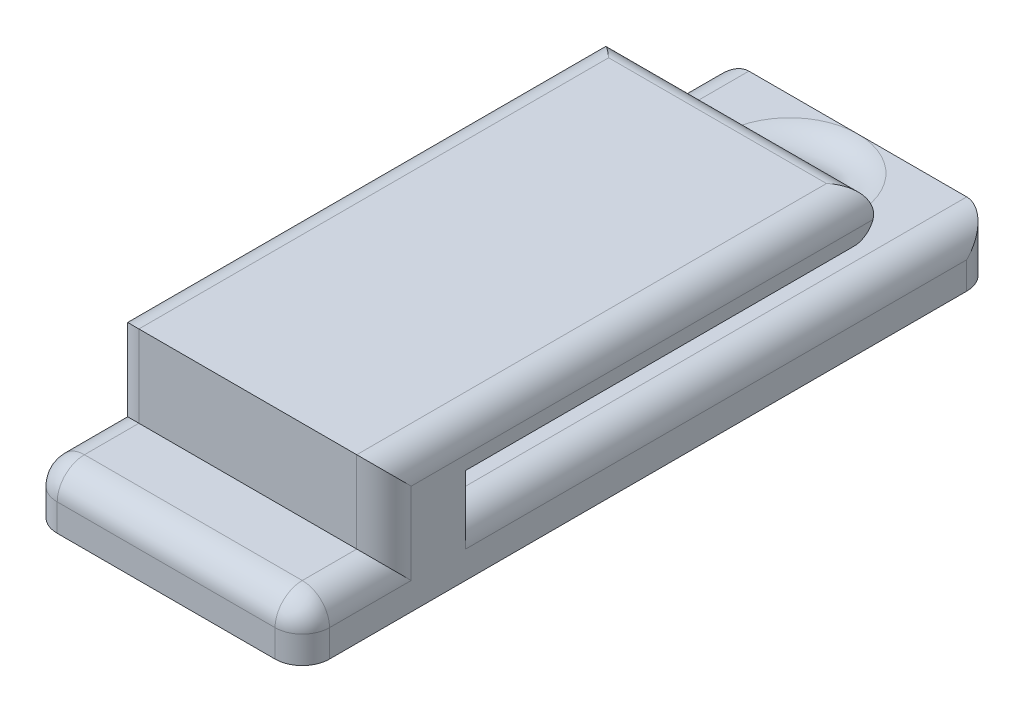
from build123d import *

# Parameters (mm, degrees)
SKETCH1_W           = 10
SKETCH1_H           = 25.4
BOSS_EXTRUDE1_DEPTH = 2
SKETCH3_W           = 10
SKETCH3_H           = 3
BOSS_EXTRUDE3_DEPTH = 3
SKETCH4_W           = 10
SKETCH4_H           = 1.5
BOSS_EXTRUDE4_DEPTH = 15
SKETCH5_R           = 1.5
CUT_EXTRUDE1_DEPTH  = 14.974619852
FILLET2_R           = 1
FILLET4_RADIUS      = 0.75
FILLET4_LENGTH      = 10
FILLET5_R           = 1
FILLET6_R           = 1
FILLET7_R           = 1
FILLET8_START       = -1
FILLET8_DEPTH       = 5
FILLET9_START       = -1
FILLET9_DEPTH       = 4
FILLET10_R          = 1
FILLET11_R          = 1


with BuildPart() as part:
    # Sketch1 → Boss-Extrude1 (new body)
    with BuildSketch(Plane(origin=(0, 0, 0), x_dir=(1, 0, 0), z_dir=(0, 1, 0))):
        Rectangle(SKETCH1_W, SKETCH1_H)
    extrude(amount=BOSS_EXTRUDE1_DEPTH)

    # Sketch3 → Boss-Extrude3 (add)
    with BuildSketch(Plane(origin=(0, 2, 0), x_dir=(1, 0, 0), z_dir=(0, 1, 0))):
        with Locations((0, -8.2)):
            Rectangle(SKETCH3_W, SKETCH3_H)
    extrude(amount=BOSS_EXTRUDE3_DEPTH)

    # Sketch4 → Boss-Extrude4 (add)
    with BuildSketch(Plane(origin=(0, 0, 6.7), x_dir=(-1, 0, 0), z_dir=(0, 0, -1))):
        with Locations((0, 4.25)):
            Rectangle(SKETCH4_W, SKETCH4_H)
    extrude(amount=BOSS_EXTRUDE4_DEPTH)

    # Sketch5 → Cut-Extrude1 (cut, through all)
    with BuildSketch(Plane(origin=(0, 2, 0), x_dir=(1, 0, 0), z_dir=(0, 1, 0))):
        with Locations(Location((0, 10.2, 0), (0, 0, 270))):
            Circle(SKETCH5_R)
    extrude(amount=-CUT_EXTRUDE1_DEPTH, mode=Mode.SUBTRACT)

    # Fillet2
    fillet2_edges = [part.edges().sort_by_distance(p)[0] for p in [
        (0, 2, -11.7),
    ]]
    fillet(fillet2_edges, radius=FILLET2_R - 0.0001)  # a hair under: the kernel refuses the full size

    # Fillet4: full round fillet: the end face becomes a half cylinder, R = half its width
    fillet4_face = Plane((0, 4.25, -8.3), x_dir=(1, 0, 0), z_dir=(0, 0, -1))  # on the end face: x along it, z out of the body
    fillet4_slab = fillet4_face.offset(-FILLET4_RADIUS / 2) * Box(FILLET4_LENGTH, 2 * FILLET4_RADIUS, FILLET4_RADIUS, mode=Mode.PRIVATE)  # the body's end, R deep
    fillet4_round = Plane((0, 4.25, -7.55), x_dir=(0, 0, -1), z_dir=(1, 0, 0)) * Cylinder(FILLET4_RADIUS, FILLET4_LENGTH, mode=Mode.PRIVATE)  # its axis R under the face
    add(fillet4_slab - fillet4_round, mode=Mode.SUBTRACT)

    # Fillet5
    # the kernel refuses this fillet: 1 mm, written as the material it takes off along each edge
    with BuildSketch(Plane(origin=(7.5, 2, 12.7), x_dir=(0, -1, 0), z_dir=(-1, 0, 0))) as fillet5_piece_1:
        with BuildLine():
            CenterArc((FILLET5_R, -FILLET5_R), FILLET5_R, 90, 90)
            Line((0, -FILLET5_R), (0, 0))
            Line((0, 0), (FILLET5_R, 0))
        make_face()
    extrude(amount=15, mode=Mode.SUBTRACT)
    with BuildSketch(Plane(origin=(-5, 2, 15.2), x_dir=(1, 0, 0), z_dir=(0, 0, -1)), Plane(origin=(-5, 2, 9.7), x_dir=(1, 0, 0), z_dir=(0, 1, 0)), Plane(origin=(5, 2, 9.7), x_dir=(0, 0, -1), z_dir=(0, 1, 0))) as fillet5_piece_2:
        with BuildLine():
            CenterArc((FILLET5_R, FILLET5_R), FILLET5_R, 180, 90)
            Line((0, FILLET5_R), (0, 0))
            Line((0, 0), (FILLET5_R, 0))
        make_face()
    extrude(amount=5.5, mode=Mode.SUBTRACT)
    with BuildSketch(Plane(origin=(5, 5, -10.05), x_dir=(0, -1, 0), z_dir=(0, 0, 1))) as fillet5_piece_3:
        with BuildLine():
            CenterArc((FILLET5_R, -FILLET5_R), FILLET5_R, 90, 90)
            Line((0, -FILLET5_R), (0, 0))
            Line((0, 0), (FILLET5_R, 0))
        make_face()
    extrude(amount=22.25, mode=Mode.SUBTRACT)
    with BuildSketch(Plane(origin=(5, 2, 9.7), x_dir=(0, -1, 0), z_dir=(0, 0, 1))) as fillet5_piece_4:
        with BuildLine():
            CenterArc((FILLET5_R, -FILLET5_R), FILLET5_R, 90, 90)
            Line((0, -FILLET5_R), (0, 0))
            Line((0, 0), (FILLET5_R, 0))
        make_face()
    extrude(amount=5.5, mode=Mode.SUBTRACT)
    with BuildSketch(Plane(origin=(-5, 5, 12.2), x_dir=(1, 0, 0), z_dir=(0, 0, -1))) as fillet5_piece_5:
        with BuildLine():
            CenterArc((FILLET5_R, FILLET5_R), FILLET5_R, 180, 90)
            Line((0, FILLET5_R), (0, 0))
            Line((0, 0), (FILLET5_R, 0))
        make_face()
    extrude(amount=22.25, mode=Mode.SUBTRACT)
    with BuildSketch(Plane(origin=(-5, 2, 15.2), x_dir=(1, 0, 0), z_dir=(0, 0, -1))) as fillet5_piece_6a_section:
        with BuildLine():
            CenterArc((FILLET5_R, FILLET5_R), FILLET5_R, 180, 90)
            Line((0, FILLET5_R), (0, 0))
            Line((0, 0), (FILLET5_R, 0))
        make_face()
    fillet5_piece_6a = extrude(amount=8, mode=Mode.PRIVATE)
    fillet5_piece_6a = split(fillet5_piece_6a, bisect_by=Plane(origin=(-5, 2, 9.7), z_dir=(0, 0, -1)), keep=Keep.TOP, mode=Mode.PRIVATE)
    with BuildSketch(Plane(origin=(-5, -0.5, 9.7), x_dir=(1, 0, 0), z_dir=(0, 1, 0))) as fillet5_piece_6b_section:
        with BuildLine():
            CenterArc((FILLET5_R, FILLET5_R), FILLET5_R, 180, 90)
            Line((0, FILLET5_R), (0, 0))
            Line((0, 0), (FILLET5_R, 0))
        make_face()
    fillet5_piece_6b = extrude(amount=8, mode=Mode.PRIVATE)
    fillet5_piece_6b = split(fillet5_piece_6b, bisect_by=Plane(origin=(-5, 2, 9.7), z_dir=(0, -1, 0)), keep=Keep.TOP, mode=Mode.PRIVATE)
    fillet5_piece_6 = fillet5_piece_6a & fillet5_piece_6b
    add(fillet5_piece_6, mode=Mode.SUBTRACT)
    with BuildSketch(Plane(origin=(5, -0.5, 9.7), x_dir=(0, 0, -1), z_dir=(0, 1, 0))) as fillet5_piece_7a_section:
        with BuildLine():
            CenterArc((FILLET5_R, FILLET5_R), FILLET5_R, 180, 90)
            Line((0, FILLET5_R), (0, 0))
            Line((0, 0), (FILLET5_R, 0))
        make_face()
    fillet5_piece_7a = extrude(amount=8, mode=Mode.PRIVATE)
    fillet5_piece_7a = split(fillet5_piece_7a, bisect_by=Plane(origin=(5, 2, 9.7), z_dir=(0, -1, 0)), keep=Keep.TOP, mode=Mode.PRIVATE)
    with BuildSketch(Plane(origin=(5, 2, 7.2), x_dir=(0, -1, 0), z_dir=(0, 0, 1))) as fillet5_piece_7b_section:
        with BuildLine():
            CenterArc((FILLET5_R, -FILLET5_R), FILLET5_R, 90, 90)
            Line((0, -FILLET5_R), (0, 0))
            Line((0, 0), (FILLET5_R, 0))
        make_face()
    fillet5_piece_7b = extrude(amount=8, mode=Mode.PRIVATE)
    fillet5_piece_7b = split(fillet5_piece_7b, bisect_by=Plane(origin=(5, 2, 9.7), z_dir=(0, 0, -1)), keep=Keep.TOP, mode=Mode.PRIVATE)
    fillet5_piece_7 = fillet5_piece_7a & fillet5_piece_7b
    add(fillet5_piece_7, mode=Mode.SUBTRACT)

    # Fillet6
    fillet6_edges = [part.edges().sort_by_distance(p)[0] for p in [
        (-5, 2, -3),
    ]]
    fillet(fillet6_edges, radius=FILLET6_R)

    # Fillet7
    fillet7_edges = [part.edges().sort_by_distance(p)[0] for p in [
        (5, 2, -3),
    ]]
    fillet(fillet7_edges, radius=FILLET7_R)

    # Fillet8: read off the stored shape, not the designer's step
    # Fillet8 outline → Fillet8 (cut)
    with BuildSketch(Plane(origin=(0, 0, 0), x_dir=(1, 0, 0), z_dir=(0, 1, 0)).offset(FILLET8_START)):
        with BuildLine():
            Line((-5, 12.7), (-5, 11.7))
            add(Edge.make_bspline(
                [(-5, 11.7), (-5, 12.7), (-4, 12.7)],
                knots=[0, 0, 0, 1, 1, 1], degree=2, weights=[1, 0.707106781, 1]))
            Line((-4, 12.7), (-5, 12.7))
        make_face()
    extrude(amount=FILLET8_DEPTH, mode=Mode.SUBTRACT)

    # Fillet9: read off the stored shape, not the designer's step
    # Fillet9 outline → Fillet9 (cut)
    with BuildSketch(Plane(origin=(0, 0, 0), x_dir=(1, 0, 0), z_dir=(0, 1, 0)).offset(FILLET9_START)):
        with BuildLine():
            Line((5, 12.7), (4, 12.7))
            add(Edge.make_bspline(
                [(4, 12.7), (5, 12.7), (5, 11.7)],
                knots=[0, 0, 0, 1, 1, 1], degree=2, weights=[1, 0.707106781, 1]))
            Line((5, 11.7), (5, 12.7))
        make_face()
    extrude(amount=FILLET9_DEPTH, mode=Mode.SUBTRACT)

    # Fillet10
    # the kernel refuses this fillet: 1 mm, written as the material it takes off along each edge
    with BuildSketch(Plane(origin=(-4, 1, 11.7), x_dir=(0, 0, 1), z_dir=(-1, 0, 0))) as fillet10_piece_1_section:
        Polygon((0, 0), (FILLET10_R, 0), (FILLET10_R, FILLET10_R), (0, FILLET10_R), align=None)
    fillet10_piece_1 = extrude(amount=FILLET10_R, mode=Mode.PRIVATE)
    fillet10_piece_1 = fillet10_piece_1 - Plane(origin=(-4, 1, 11.7), x_dir=(0, -0.7071067811865475, -0.7071067811865475), z_dir=(-1, 0, 0)) * Sphere(FILLET10_R, mode=Mode.PRIVATE)
    add(fillet10_piece_1, mode=Mode.SUBTRACT)
    with BuildSketch(Plane(origin=(-5, -2.5, 12.7), x_dir=(0, 0, -1), z_dir=(0, 1, 0))) as fillet10_piece_2:
        with BuildLine():
            CenterArc((FILLET10_R, -FILLET10_R), FILLET10_R, 90, 90)
            Line((0, -FILLET10_R), (0, 0))
            Line((0, 0), (FILLET10_R, 0))
        make_face()
    extrude(amount=3.5, mode=Mode.SUBTRACT)

    # Fillet11
    # the kernel refuses this fillet: 1 mm, written as the material it takes off along each edge
    with BuildSketch(Plane(origin=(4, 1, 11.7), x_dir=(0, 0, 1), z_dir=(1, 0, 0))) as fillet11_piece_1_section:
        Polygon((0, 0), (FILLET11_R, 0), (FILLET11_R, -FILLET11_R), (0, -FILLET11_R), align=None)
    fillet11_piece_1 = extrude(amount=FILLET11_R, mode=Mode.PRIVATE)
    fillet11_piece_1 = fillet11_piece_1 - Plane(origin=(4, 1, 11.7), x_dir=(0, -0.7071067811865475, -0.7071067811865475), z_dir=(1, 0, 0)) * Sphere(FILLET11_R, mode=Mode.PRIVATE)
    add(fillet11_piece_1, mode=Mode.SUBTRACT)
    with BuildSketch(Plane(origin=(5, -2.5, 12.7), x_dir=(0, 0, -1), z_dir=(0, 1, 0))) as fillet11_piece_2:
        with BuildLine():
            CenterArc((FILLET11_R, FILLET11_R), FILLET11_R, 180, 90)
            Line((0, FILLET11_R), (0, 0))
            Line((0, 0), (FILLET11_R, 0))
        make_face()
    extrude(amount=3.5, mode=Mode.SUBTRACT)


solid = part.part
